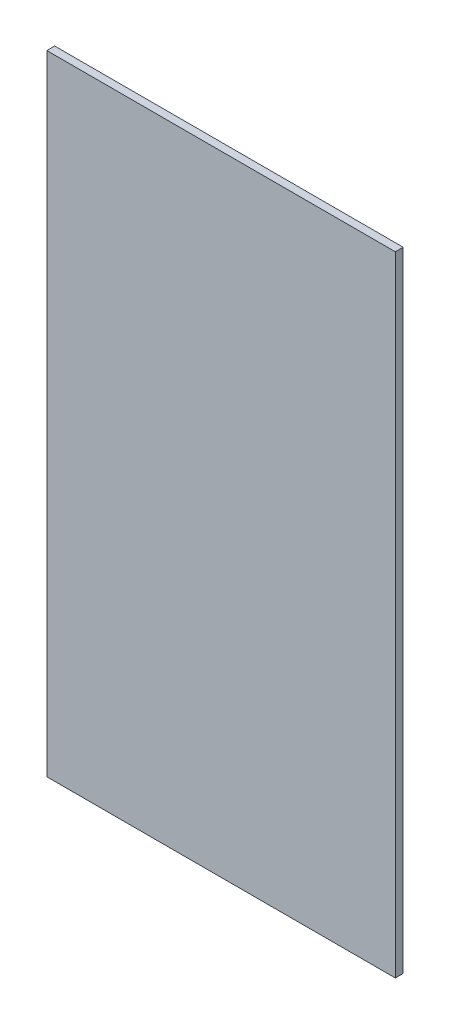
from build123d import *

# Parameters (mm, degrees)
ESQUISSE1_W        = 133
ESQUISSE1_H        = 240
BOSS_EXTRU_1_DEPTH = 3


with BuildPart() as part:
    # Esquisse1 → Boss.-Extru.1 (new body)
    with BuildSketch(Plane.XY):
        with Locations((3.58976766, -70.682741117)):
            Rectangle(ESQUISSE1_W, ESQUISSE1_H)
    extrude(amount=BOSS_EXTRU_1_DEPTH)


solid = part.part
